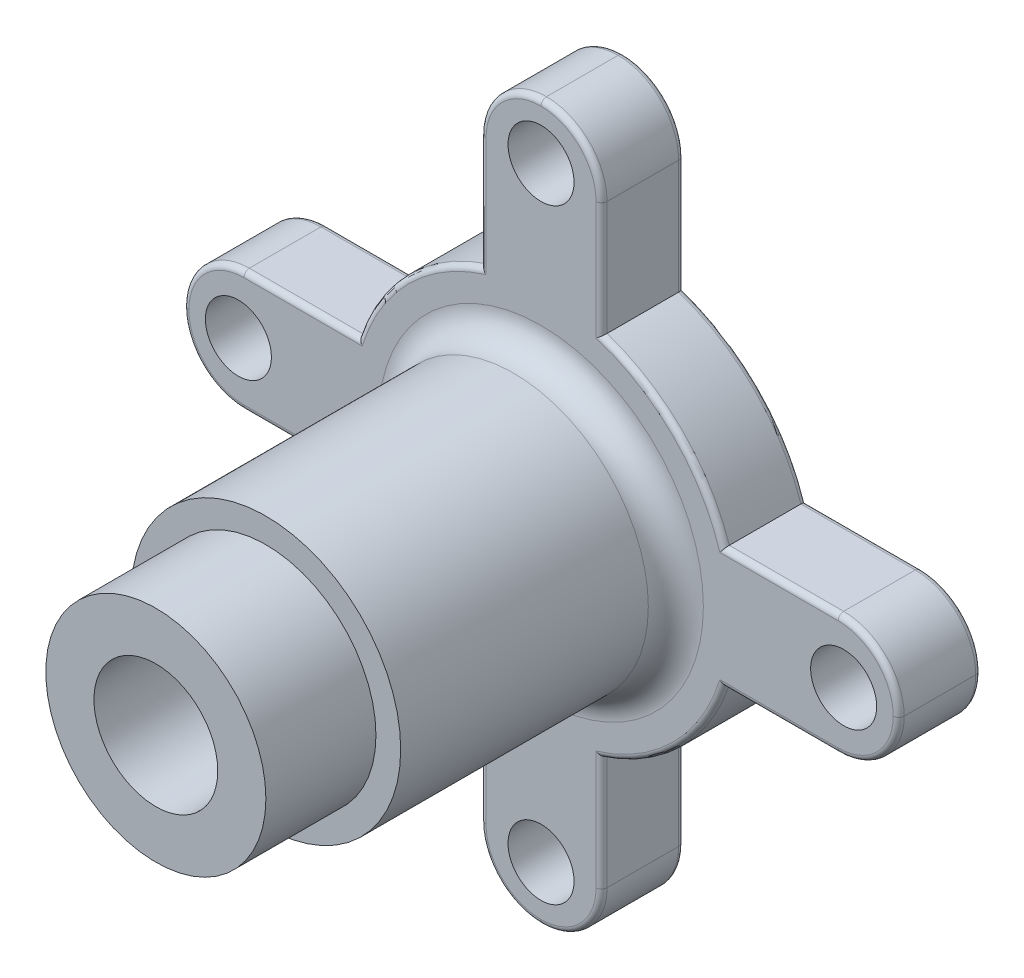
from build123d import *

# Parameters (mm, degrees)
SKETCH1_R           = 6
SKETCH1_R_2         = 20
BOSS_EXTRUDE1_DEPTH = 15
SKETCH5_R           = 24.5
SKETCH5_R_2         = 20
BOSS_EXTRUDE2_DEPTH = 50
SKETCH7_R           = 20
SKETCH7_R_2         = 11.25
BOSS_EXTRUDE3_DEPTH = 20
FILLET1_R           = 11
FILLET2_R           = 5
FILLET3_R           = 1
FILLET4_R           = 1


with BuildPart() as part:
    # Sketch1 → Boss-Extrude1 (new body)
    with BuildSketch(Plane.XY):
        with BuildLine():
            Line((-11, -33.226495452), (-11, -65))
            Line((-11, -65), (11, -65))
            Line((11, -65), (11, -33.226495452))
            ThreePointArc((11, -33.226495452), (24.748737342, -24.748737342), (33.226495452, -11))
            Line((33.226495452, -11), (65, -11))
            Line((65, -11), (65, 11))
            Line((65, 11), (33.226495452, 11))
            ThreePointArc((33.226495452, 11), (24.748737342, 24.748737342), (11, 33.226495452))
            Line((11, 33.226495452), (11, 65))
            Line((11, 65), (-11, 65))
            Line((-11, 65), (-11, 33.226495452))
            ThreePointArc((-11, 33.226495452), (-24.748737342, 24.748737342), (-33.226495452, 11))
            Line((-33.226495452, 11), (-65, 11))
            Line((-65, 11), (-65, -11))
            Line((-65, -11), (-33.226495452, -11))
            ThreePointArc((-33.226495452, -11), (-24.748737342, -24.748737342), (-11, -33.226495452))
        make_face()
        with Locations((0, 55)):
            Circle(SKETCH1_R, mode=Mode.SUBTRACT)
        with Locations((55, 0)):
            Circle(SKETCH1_R, mode=Mode.SUBTRACT)
        with Locations((0, -55)):
            Circle(SKETCH1_R, mode=Mode.SUBTRACT)
        with Locations((-55, 0)):
            Circle(SKETCH1_R, mode=Mode.SUBTRACT)
        Circle(SKETCH1_R_2, mode=Mode.SUBTRACT)
    extrude(amount=BOSS_EXTRUDE1_DEPTH)

    # Sketch5 → Boss-Extrude2 (add)
    with BuildSketch(Plane.XY.offset(15)):
        Circle(SKETCH5_R)
        Circle(SKETCH5_R_2, mode=Mode.SUBTRACT)
    extrude(amount=BOSS_EXTRUDE2_DEPTH)

    # Fillet1
    fillet1_edges = [part.edges().sort_by_distance(p)[0] for p in [
        (-65, 11, 7.5),
        (-65, -11, 7.5),
        (-11, -65, 7.5),
        (11, -65, 7.5),
        (-11, 65, 7.5),
        (11, 65, 7.5),
        (65, -11, 7.5),
        (65, 11, 7.5),
    ]]
    fillet(fillet1_edges, radius=FILLET1_R - 0.0001)  # a hair under: the kernel refuses the full size

    # Fillet2
    fillet2_edges = [part.edges().sort_by_distance(p)[0] for p in [
        (-24.5, 0, 15),
    ]]
    fillet(fillet2_edges, radius=FILLET2_R)

    # Fillet3
    fillet3_edges = [part.edges().sort_by_distance(p)[0] for p in [
        (-24.748737342, 24.748737342, 15),
        (-24.748737342, -24.748737342, 15),
        (-11, -43.613297726, 15),
        (11, -43.613297726, 15),
        (24.748737342, -24.748737342, 15),
        (43.613297726, -11, 15),
        (43.613297726, 11, 15),
        (24.748737342, 24.748737342, 15),
        (-43.613297726, 11, 15),
        (-43.613297726, -11, 15),
        (11, 43.613297726, 15),
        (-11, 43.613297726, 15),
        (61.778203882, 7.778203882, 15),
        (61.778203882, -7.778203882, 15),
        (7.778203882, 61.778203882, 15),
        (-7.778203882, 61.778203882, 15),
        (7.778203882, -61.778203882, 15),
        (-7.778203882, -61.778203882, 15),
        (-61.778203882, -7.778203882, 15),
        (-61.778203882, 7.778203882, 15),
    ]]
    fillet(fillet3_edges, radius=FILLET3_R)

    # Fillet4
    fillet4_edges = [part.edges().sort_by_distance(p)[0] for p in [
        (-24.748737342, 24.748737342, 0),
        (24.748737342, 24.748737342, 0),
        (43.613297726, 11, 0),
        (43.613297726, -11, 0),
        (24.748737342, -24.748737342, 0),
        (11, -43.613297726, 0),
        (-11, -43.613297726, 0),
        (-24.748737342, -24.748737342, 0),
        (-43.613297726, -11, 0),
        (-43.613297726, 11, 0),
        (-11, 43.613297726, 0),
        (11, 43.613297726, 0),
        (61.778203882, 7.778203882, 0),
        (61.778203882, -7.778203882, 0),
        (7.778203882, 61.778203882, 0),
        (-7.778203882, 61.778203882, 0),
        (7.778203882, -61.778203882, 0),
        (-7.778203882, -61.778203882, 0),
        (-61.778203882, -7.778203882, 0),
        (-61.778203882, 7.778203882, 0),
    ]]
    fillet(fillet4_edges, radius=FILLET4_R)


with BuildPart() as body_2:
    # Sketch7 → Boss-Extrude3 (new body)
    with BuildSketch(Plane.XY.offset(65)):
        Circle(SKETCH7_R)
        Circle(SKETCH7_R_2, mode=Mode.SUBTRACT)
    extrude(amount=BOSS_EXTRUDE3_DEPTH)


solid = Compound([part.part, body_2.part])
